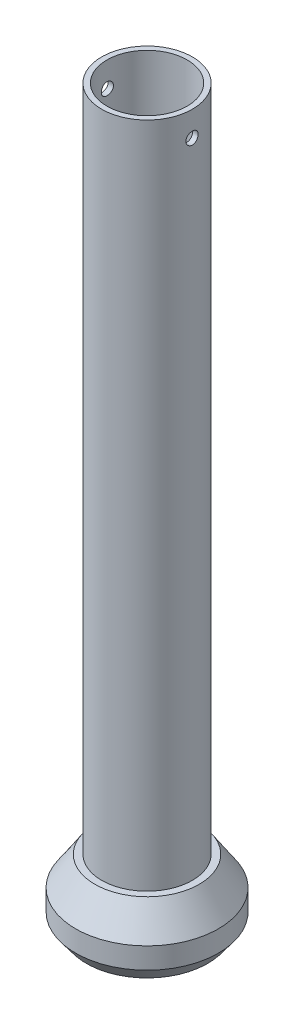
from build123d import *

# Parameters (mm, degrees)
SKETCH1_R               = 12.7
SKETCH1_R_2             = 11.227
BOSS_EXTRUDE1_DEPTH     = 205
CUT_EXTRUDE1_DEPTH      = 207.942020866
CUT_EXTRUDE1_DEPTH_BACK = 207.942020866
SKETCH3_R               = 1.7


with BuildPart() as part:
    # Sketch1 → Boss-Extrude1 (new body)
    with BuildSketch(Plane(origin=(0, 0, 0), x_dir=(1, 0, 0), z_dir=(0, 1, 0))):
        Circle(SKETCH1_R)
        Circle(SKETCH1_R_2, mode=Mode.SUBTRACT)
    extrude(amount=BOSS_EXTRUDE1_DEPTH)

    # Sketch2 → Revolve1 (revolve)
    with BuildSketch(Plane.XY):
        Polygon((0, 0), (17, 0), (20, 4), (20, 9.9), (14.605, 18), (0, 18), align=None)
    revolve(axis=Axis((0, -10, 0), (0, 1, 0)))

    # Sketch3 → Cut-Extrude1 (cut, two sides: drawn at the far end of the back side and taken through both)
    with BuildSketch(Plane(origin=(0, 0, 0), x_dir=(0, 0, -1), z_dir=(1, 0, 0)).offset(-CUT_EXTRUDE1_DEPTH_BACK)):
        with Locations((0, 198)):
            Circle(SKETCH3_R)
    extrude(amount=CUT_EXTRUDE1_DEPTH + CUT_EXTRUDE1_DEPTH_BACK, mode=Mode.SUBTRACT)


solid = part.part
